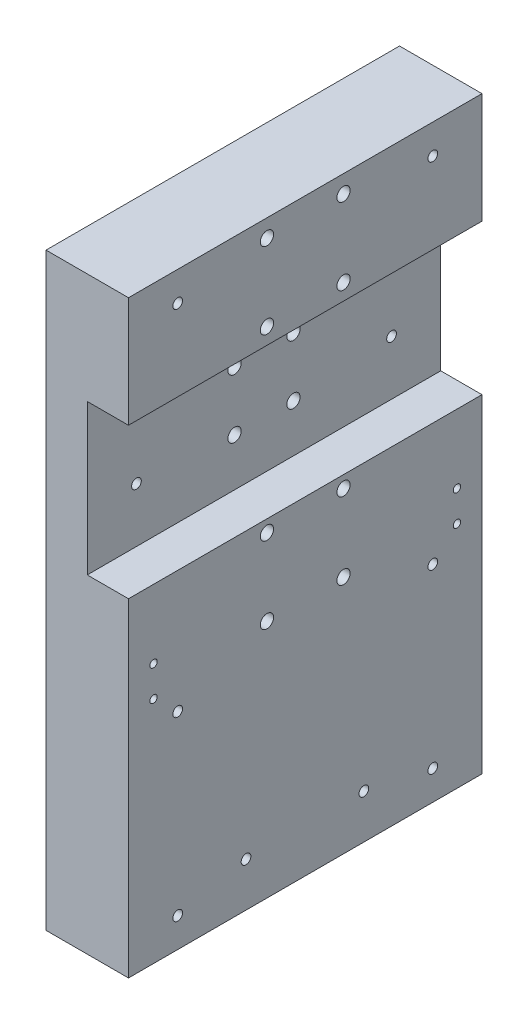
from build123d import *

# Parameters (mm, degrees)
BOSS_EXTRUDE1_DEPTH            = 120
CBORE_FOR_M4_SHCS4_D           = 4.5
CBORE_FOR_M4_SHCS4_CBORE_D     = 8
CBORE_FOR_M4_SHCS4_CBORE_DEPTH = 4
M4_TAPPED_HOLE1_D              = 3.3
M5_TAPPED_HOLE1_D              = 4.2
M5_TAPPED_HOLE1_DEPTH          = 17.4
M5_TAPPED_HOLE1_TIP            = 1.2618073
M4_TAPPED_HOLE2_D              = 3.3
M3_TAPPED_HOLE1_D              = 2.5
M3_TAPPED_HOLE1_DEPTH          = 7.5
M3_TAPPED_HOLE1_TIP            = 0.751075774


with BuildPart() as part:
    # Sketch1 → Boss-Extrude1 (new body)
    with BuildSketch(Plane.XY):
        Polygon((0, 0), (0, 200), (28, 200), (28, 162.5), (14, 162.5), (14, 111.5), (28, 111.5), (28, 0), align=None)
    extrude(amount=BOSS_EXTRUDE1_DEPTH)

    # CBORE for M4 SHCS4 (through all)
    with Locations(Plane(origin=(0, 194, 73), x_dir=(0, 0, -1), z_dir=(-1, 0, 0))):
        with Locations((0, 0), (0, 26), (3, 46.3), (3, 66.3), (0, 86.6), (0, 112.6), (26, 112.6), (26, 86.6), (23, 66.3), (23, 46.3), (26, 26), (26, 0)):
            CounterBoreHole(CBORE_FOR_M4_SHCS4_D / 2, CBORE_FOR_M4_SHCS4_CBORE_D / 2, CBORE_FOR_M4_SHCS4_CBORE_DEPTH)

    # M4 Tapped Hole1 (through all)
    with Locations(Plane(origin=(0, 190, 16.7), x_dir=(0, 0, -1), z_dir=(-1, 0, 0))):
        with Locations((0, 0), (0, 60), (0, 120), (0, 180), (-86.6, 180), (-86.6, 120), (-86.6, 60), (-86.6, 0)):
            Hole(M4_TAPPED_HOLE1_D / 2)

    # M5 Tapped Hole1
    with Locations(Plane(origin=(14, 0, 90), x_dir=(-1, 0, 0), z_dir=(0, -1, 0))):
        with Locations((0, 0), (0, 30), (0, 60)):
            Hole(M5_TAPPED_HOLE1_D / 2, depth=M5_TAPPED_HOLE1_DEPTH)
            with Locations((0, 0, -(M5_TAPPED_HOLE1_DEPTH + M5_TAPPED_HOLE1_TIP / 2))):  # 118° drill point
                Cone(0, M5_TAPPED_HOLE1_D / 2, M5_TAPPED_HOLE1_TIP, mode=Mode.SUBTRACT)

    # M4 Tapped Hole2 (through all)
    with Locations(Plane(origin=(28, 15, 80.1), x_dir=(0, 1, 0), z_dir=(1, 0, 0))):
        with Locations((0, 0), (0, -40)):
            Hole(M4_TAPPED_HOLE2_D / 2)

    # M3 Tapped Hole1
    with Locations(Plane(origin=(28, 88.175, 8.5), x_dir=(0, 1, 0), z_dir=(1, 0, 0))):
        with Locations((0, 0), (-10.4, 0), (0, 103), (-10.4, 103)):
            Hole(M3_TAPPED_HOLE1_D / 2, depth=M3_TAPPED_HOLE1_DEPTH)
            with Locations((0, 0, -(M3_TAPPED_HOLE1_DEPTH + M3_TAPPED_HOLE1_TIP / 2))):  # 118° drill point
                Cone(0, M3_TAPPED_HOLE1_D / 2, M3_TAPPED_HOLE1_TIP, mode=Mode.SUBTRACT)


solid = part.part
